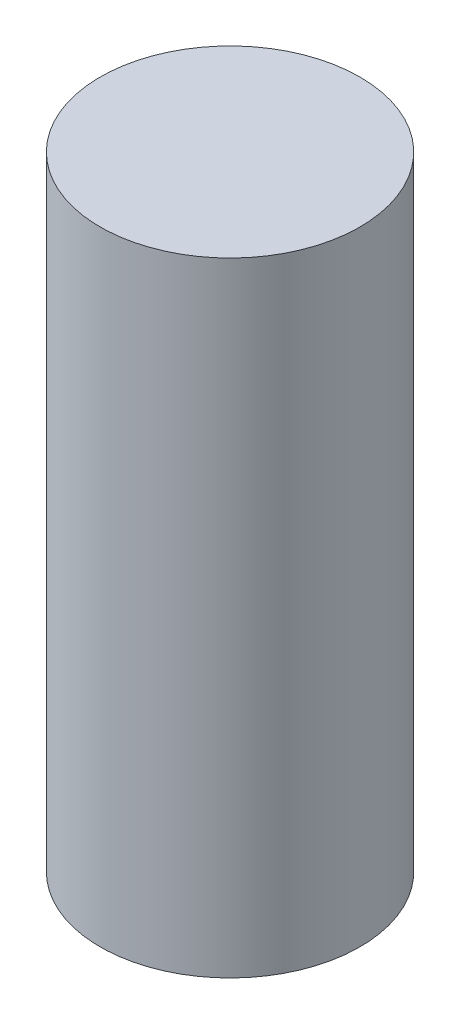
from build123d import *

# Parameters (mm, degrees)
MAIN_PARACHUTE_BAG_PROFILE_R  = 63.5
MAIN_PARACHUTE_BAG_BODY_DEPTH = 304.8


with BuildPart() as part:
    # Main Parachute Bag Profile → Main Parachute Bag Body (new body)
    with BuildSketch(Plane(origin=(0, 0, 0), x_dir=(1, 0, 0), z_dir=(0, 1, 0))):
        Circle(MAIN_PARACHUTE_BAG_PROFILE_R)
    extrude(amount=MAIN_PARACHUTE_BAG_BODY_DEPTH)


solid = part.part
